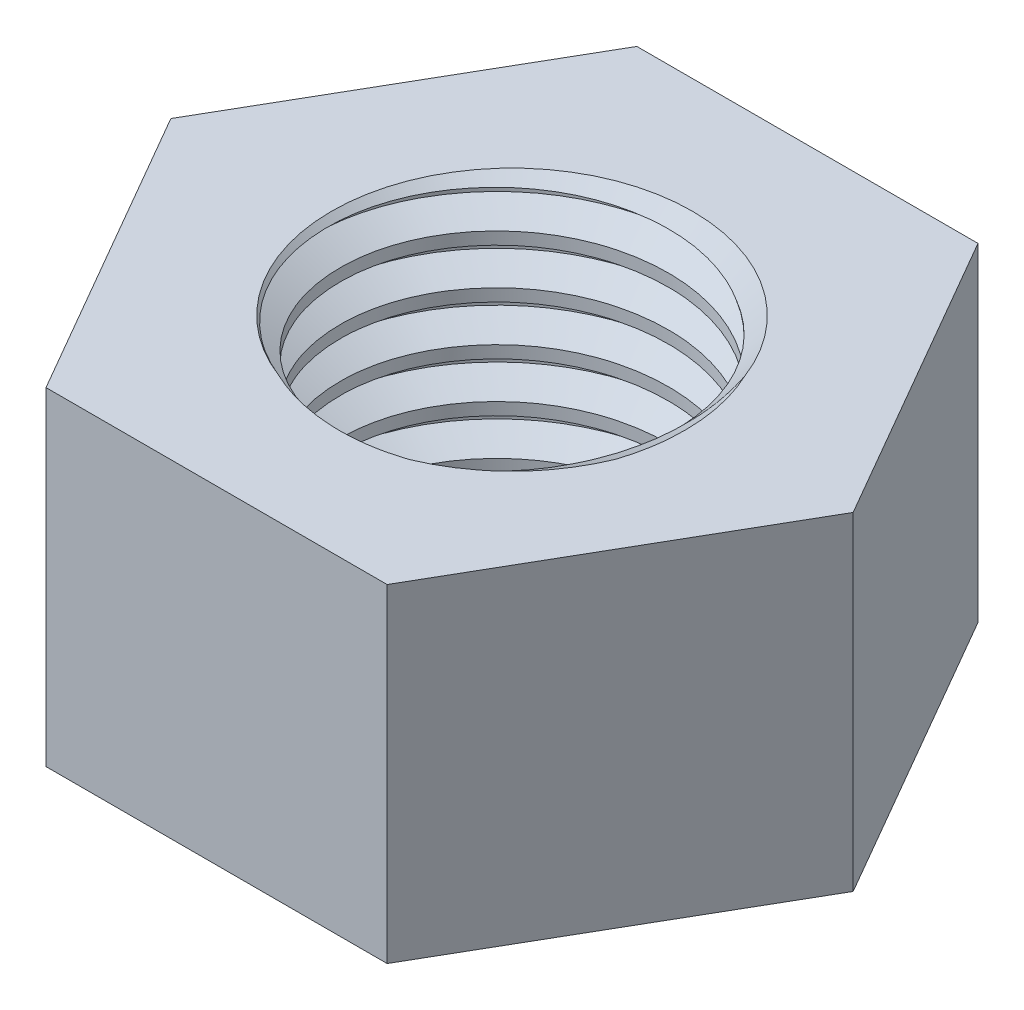
from build123d import *

# Parameters (mm, degrees)
BOSS_EXTRUDE1_DEPTH = 10
SKETCH2_R           = 5
CUT_EXTRUDE1_DEPTH  = 10
CHAMFER1_SIZE       = 0.5
THREAD2_PITCH       = 1.5


with BuildPart() as part:
    # Sketch1 → Boss-Extrude1 (new body)
    with BuildSketch(Plane(origin=(0, 0, 0), x_dir=(1, 0, 0), z_dir=(0, 1, 0))):
        Polygon((10.392304845, 0), (5.196152423, 9), (-5.196152423, 9), (-10.392304845, 0), (-5.196152423, -9), (5.196152423, -9), align=None)
    extrude(amount=BOSS_EXTRUDE1_DEPTH)

    # Sketch2 → Cut-Extrude1 (cut)
    with BuildSketch(Plane(origin=(0, 10, 0), x_dir=(1, 0, 0), z_dir=(0, 1, 0))):
        with Locations(Location((0, 0, 0), (0, 0, 270))):
            Circle(SKETCH2_R)
    extrude(amount=-CUT_EXTRUDE1_DEPTH, mode=Mode.SUBTRACT)

    # Chamfer1
    chamfer1_edges = [part.edges().sort_by_distance(p)[0] for p in [
        (0, 0, -5),
        (0, 10, -5),
    ]]
    chamfer(chamfer1_edges, length=CHAMFER1_SIZE)

    # Thread2: the profile of Thread Profile3 profile screwed along a right-hand helix of 7.666667 turns, 8 arcs to a turn; built about Z, then put on its axis
    thread2_z = Axis((0, 0, 0), (0, 0, 1))
    thread2_corners = [(4.9997, 0, -0.000173205), (5.811898812, 0, 0.468749998), (5.811898812, 0, 0.656249998), (4.9997, 0, 1.125173201)]
    with BuildLine(mode=Mode.PRIVATE) as thread2_profile:
        Line(thread2_corners[0], thread2_corners[1])
        Line(thread2_corners[1], thread2_corners[2])
        Line(thread2_corners[2], thread2_corners[3])
        Line(thread2_corners[3], thread2_corners[0])
    thread2_cap = Face(thread2_profile.wire())
    thread2_turn_angles = [0, 22.5, 45, 67.5, 90, 112.5, 135, 157.5, 180, 202.5, 225, 247.5, 270, 292.5, 315, 337.5, 360]
    thread2_turn_weights = [1, 0.9238795325112867, 1, 0.9238795325112867, 1, 0.9238795325112867, 1, 0.9238795325112867, 1, 0.9238795325112867, 1, 0.9238795325112867, 1, 0.9238795325112867, 1, 0.9238795325112867, 1]
    thread2_turn_rails = [Edge.make_bspline([Vector(p[0], p[1], 0).rotate(thread2_z, thread2_turn_angles[k]) / thread2_turn_weights[k] + Vector(0, 0, p[2] + THREAD2_PITCH * thread2_turn_angles[k] / 360) for k in range(17)], [0, 0, 0, 1, 1, 2, 2, 3, 3, 4, 4, 5, 5, 6, 6, 7, 7, 8, 8, 8], 2, thread2_turn_weights) for p in thread2_corners]
    thread2_turn_sides = [Face.make_surface_from_curves(thread2_turn_rails[p[0]], thread2_turn_rails[p[1]]) for p in [(0, 1), (1, 2), (2, 3), (3, 0)]]
    thread2_last_angles = [2520, 2542.5, 2565, 2587.5, 2610, 2632.5, 2655, 2677.5, 2700, 2722.5, 2745, 2752.5, 2760]
    thread2_last_weights = [1, 0.9238795325112867, 1, 0.9238795325112867, 1, 0.9238795325112867, 1, 0.9238795325112867, 1, 0.9238795325112867, 1, 0.9914448613738088, 1]
    thread2_last_rails = [Edge.make_bspline([Vector(p[0], p[1], 0).rotate(thread2_z, thread2_last_angles[k]) / thread2_last_weights[k] + Vector(0, 0, p[2] + THREAD2_PITCH * thread2_last_angles[k] / 360) for k in range(13)], [0, 0, 0, 1, 1, 2, 2, 3, 3, 4, 4, 5, 5, 6, 6, 6], 2, thread2_last_weights) for p in thread2_corners]
    thread2_last_sides = [Face.make_surface_from_curves(thread2_last_rails[p[0]], thread2_last_rails[p[1]]) for p in [(0, 1), (1, 2), (2, 3), (3, 0)]]
    thread2 = Plane(origin=(0, 11.5, 0), x_dir=(-1, 0, 0), z_dir=(0, -1, 0)) * Solid(Shell([*[p.moved(Location((0, 0, THREAD2_PITCH * i))) for i in range(7) for p in thread2_turn_sides], *thread2_last_sides, thread2_cap, thread2_cap.rotate(thread2_z, 2760).moved(Location((0, 0, THREAD2_PITCH * 2760 / 360)))]))
    add(thread2, mode=Mode.SUBTRACT)


solid = part.part
